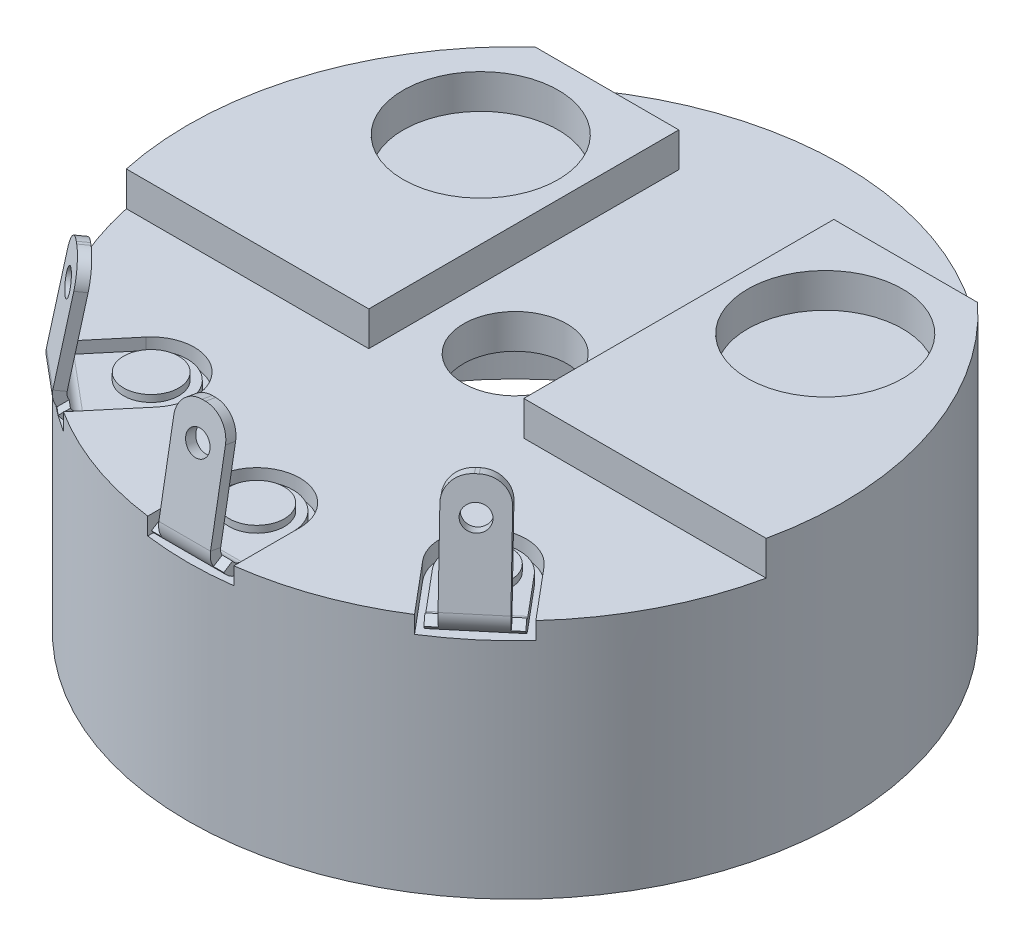
from build123d import *
from build123d.topology import SkipClean

# Parameters (mm, degrees)
SKETCH1_R                  = 0.75
BOSS_EXTRUDE2_DEPTH        = 0.5
SKETCH1_4_R                = 1.125
BOSS_EXTRUDE3_DEPTH        = 1
SKETCH1_5_R                = 1.125
BOSS_EXTRUDE4_DEPTH        = 0.5
SKETCH1_6_R                = 1.125
BOSS_EXTRUDE5_DEPTH        = 0.5
SKETCH2_R                  = 0.375
CUT_EXTRUDE1_DEPTH         = 7.736096793
CUT_EXTRUDE2_START         = -0.25
CUT_EXTRUDE2_DEPTH         = 0.25
CIRPATTERN2_COUNT          = 3
CIRPATTERN2_ANGLE          = 80
EXTRUDE_THIN2_START        = -3
SKETCH1_8_R                = 4.75
SKETCH1_8_R_2              = 4.5
EXTRUDE_THIN2_DEPTH        = 3
BASE_FLANGE1_START         = 0.15
SKETCH4_R                  = 0.375
SKETCH4_R_2                = 0.175
BASE_FLANGE1_DEPTH         = 0.15
SKETCHED_START             = -0.525
SKETCHED_BEND1_DEPTH       = 1.05
SKETCHED_BEND1_2_DEPTH     = 1.05
SKETCHED_START_2           = -0.375
SKETCHED_BEND1_3_DEPTH     = 0.75
SKETCHED_START_3           = -4.828299493
SKETCHED_BEND1_4_OUTLINE_R = 0.175
SKETCHED_BEND1_4_DEPTH     = 0.149999999
SKETCH10_R                 = 0.375
BASE_FLANGE3_DEPTH         = 0.15
CIRPATTERN3_COUNT          = 3
CIRPATTERN3_ANGLE          = 80


with BuildPart() as part:
    # Sketch1 → Boss-Extrude2 (new body)
    with BuildSketch(Plane(origin=(0, 0, 0), x_dir=(1, 0, 0), z_dir=(0, 1, 0))):
        with BuildLine():
            Line((-1.125, 3.5), (-1.125, -1))
            Line((-1.125, -1), (-4.643543905, -1))
            ThreePointArc((-4.643543905, -1), (0, -4.75), (4.643543905, -1))
            Line((4.643543905, -1), (1.125, -1))
            Line((1.125, -1), (1.125, 3.5))
            Line((1.125, 3.5), (3.211308145, 3.5))
            ThreePointArc((3.211308145, 3.5), (0, 4.75), (-3.211308145, 3.5))
            Line((-3.211308145, 3.5), (-1.125, 3.5))
        make_face()
        with Locations(Location((0, 0, 0), (0, 0, 270))):
            Circle(SKETCH1_R, mode=Mode.SUBTRACT)
    extrude(amount=BOSS_EXTRUDE2_DEPTH)

    # Sketch1<4> → Boss-Extrude3 (add)
    # profile 1 of 2: a face of its own
    with BuildSketch(Plane(origin=(0, 0, 0), x_dir=(1, 0, 0), z_dir=(0, 1, 0))):
        with BuildLine():
            ThreePointArc((-3.211308145, 3.5), (-4.526276083, 1.440598771), (-4.643543905, -1))
            Line((-4.643543905, -1), (-1.125, -1))
            Line((-1.125, -1), (-1.125, 3.5))
            Line((-1.125, 3.5), (-3.211308145, 3.5))
        make_face()
        with Locations(Location((-2.5, 2, 0), (0, 0, 270))):
            Circle(SKETCH1_4_R, mode=Mode.SUBTRACT)
    # profile 2 of 2: a face of its own
    with BuildSketch(Plane(origin=(0, 0, 0), x_dir=(1, 0, 0), z_dir=(0, 1, 0))):
        with BuildLine():
            Line((1.125, -1), (4.643543905, -1))
            ThreePointArc((4.643543905, -1), (4.723310997, -0.502825243), (4.75, 0))
            ThreePointArc((4.75, 0), (4.348345299, 1.911646713), (3.211308145, 3.5))
            Line((3.211308145, 3.5), (1.125, 3.5))
            Line((1.125, 3.5), (1.125, -1))
        make_face()
        with Locations(Location((2.5, 2, 0), (0, 0, 270))):
            Circle(SKETCH1_4_R, mode=Mode.SUBTRACT)
    extrude(amount=BOSS_EXTRUDE3_DEPTH)

    # Sketch1<5> → Boss-Extrude4 (add)
    with BuildSketch(Plane(origin=(0, 0, 0), x_dir=(1, 0, 0), z_dir=(0, 1, 0))):
        with Locations(Location((2.5, 2, 0), (0, 0, 270))):
            Circle(SKETCH1_5_R)
    extrude(amount=BOSS_EXTRUDE4_DEPTH)

    # Sketch1<6> → Boss-Extrude5 (add)
    with BuildSketch(Plane(origin=(0, 0, 0), x_dir=(1, 0, 0), z_dir=(0, 1, 0))):
        with Locations(Location((-2.5, 2, 0), (0, 0, 270))):
            Circle(SKETCH1_6_R)
    extrude(amount=BOSS_EXTRUDE5_DEPTH)

    # Sketch2 → Cut-Extrude1 (cut, through all)
    with BuildSketch(Plane(origin=(0, 0.5, 0), x_dir=(1, 0, 0), z_dir=(0, 1, 0))):
        with Locations(Location((-2.410453536, -2.872666662, 0), (0, 0, 270))):
            Circle(SKETCH2_R)
    cut_extrude1 = extrude(amount=-CUT_EXTRUDE1_DEPTH, mode=Mode.SUBTRACT)

    # Sketch2<4> → Cut-Extrude2 (cut)
    with BuildSketch(Plane(origin=(0, 0.5, 0), x_dir=(1, 0, 0), z_dir=(0, 1, 0)).offset(CUT_EXTRUDE2_START)):
        with BuildLine():
            Line((-3.505473113, -3.205332784), (-2.889231313, -2.470924406))
            ThreePointArc((-2.889231313, -2.470924406), (-2.00871128, -2.393888885), (-1.931675759, -3.274408918))
            Line((-1.931675759, -3.274408918), (-2.547917559, -4.008817296))
            ThreePointArc((-2.547917559, -4.008817296), (-3.053241146, -3.638711105), (-3.505473113, -3.205332784))
        make_face()
    cut_extrude2 = extrude(amount=CUT_EXTRUDE2_DEPTH, mode=Mode.SUBTRACT)

    # CirPattern2: Cut-Extrude1, Cut-Extrude2 ×3 about axis
    cirpattern2_axis = Axis((0, 0, 0), (0, 1, 0))
    add([cut_extrude1.rotate(cirpattern2_axis, i * CIRPATTERN2_ANGLE / (CIRPATTERN2_COUNT - 1)) for i in range(1, CIRPATTERN2_COUNT)], mode=Mode.SUBTRACT)
    add([cut_extrude2.rotate(cirpattern2_axis, i * CIRPATTERN2_ANGLE / (CIRPATTERN2_COUNT - 1)) for i in range(1, CIRPATTERN2_COUNT)], mode=Mode.SUBTRACT)

    # Sketch1<8> → Extrude-Thin2 (add)
    with BuildSketch(Plane(origin=(0, 0, 0), x_dir=(1, 0, 0), z_dir=(0, 1, 0)).offset(EXTRUDE_THIN2_START)):
        Circle(SKETCH1_8_R)
        Circle(SKETCH1_8_R_2, mode=Mode.SUBTRACT)
    extrude(amount=EXTRUDE_THIN2_DEPTH)


with BuildPart() as body_2:
    # Base-Flange1: sheet metal written as solids
    # Sketch4 → Base-Flange1 (new body)
    with BuildSketch(Plane(origin=(0, 0.25, 0), x_dir=(1, 0, 0), z_dir=(0, 1, 0)).offset(BASE_FLANGE1_START)):
        with BuildLine():
            Line((-2.008280204, -3.210130157), (-2.624522003, -3.944538535))
            Line((-2.624522003, -3.944538535), (-2.73942867, -3.848120394))
            Line((-2.73942867, -3.848120394), (-3.639331323, -4.920582614))
            ThreePointArc((-3.639331323, -4.920582614), (-3.876942368, -5.044275095), (-4.132422542, -4.963722506))
            Line((-4.132422542, -4.963722506), (-4.170724764, -4.931583125))
            ThreePointArc((-4.170724764, -4.931583125), (-4.294417245, -4.69397208), (-4.213864655, -4.438491907))
            Line((-4.213864655, -4.438491907), (-3.313962002, -3.366029686))
            Line((-3.313962002, -3.366029686), (-3.428868668, -3.269611545))
            Line((-3.428868668, -3.269611545), (-2.812626869, -2.535203167))
            ThreePointArc((-2.812626869, -2.535203167), (-2.072990041, -2.470493329), (-2.008280204, -3.210130157))
        make_face()
        with Locations(Location((-2.410453536, -2.872666662, 0), (0, 0, 270))):
            Circle(SKETCH4_R, mode=Mode.SUBTRACT)
        with Locations(Location((-3.830179848, -4.564630594, 0), (0, 0, 270))):
            Circle(SKETCH4_R_2, mode=Mode.SUBTRACT)
    extrude(amount=-BASE_FLANGE1_DEPTH)

    # Sketched Bend1: read off the stored shape, not the designer's step
    # Sketched Bend1 outline → Sketched Bend1 (cut)
    with BuildSketch(Plane(origin=(0, 0, 0), x_dir=(0.642787609686537, 0, -0.76604444311898), z_dir=(0.76604444311898, 0, 0.642787609686537)).offset(SKETCHED_START)):
        with BuildLine():
            Line((-4.760983594, 0.4), (-6.45870205, 0.4))
            Line((-6.45870205, 0.4), (-6.45870205, 0.25))
            Line((-6.45870205, 0.25), (-4.501175973, 0.25))
            ThreePointArc((-4.501175973, 0.25), (-4.651175973, 0.290192379), (-4.760983594, 0.4))
        make_face()
    extrude(amount=SKETCHED_BEND1_DEPTH, mode=Mode.SUBTRACT)

    # Sketched Bend1 2 outline → Sketched Bend1 2 (add)
    with SkipClean():  # the faces are left unmerged after this step: merging them gives an invalid solid
        with BuildSketch(Plane(origin=(0, 0, 0), x_dir=(0.642787609686537, 0, -0.76604444311898), z_dir=(0.76604444311898, 0, 0.642787609686537)).offset(SKETCHED_START)):
            with BuildLine():
                ThreePointArc((-4.501175973, 0.4), (-4.57325702, 0.418454105), (-4.627602184, 0.469275698))
                Line((-4.627602184, 0.469275698), (-4.754028396, 0.388551395))
                ThreePointArc((-4.754028396, 0.388551395), (-4.73301345, 0.359602037), (-4.70870205, 0.333359913))
                Line((-4.70870205, 0.333359913), (-4.70870205, 0.4))
                Line((-4.70870205, 0.4), (-4.501175973, 0.4))
            make_face()
        extrude(amount=SKETCHED_BEND1_2_DEPTH)

    # Sketched Bend1 3 outline → Sketched Bend1 3 (add)
    with SkipClean():  # the faces are left unmerged after this step: merging them gives an invalid solid
        with BuildSketch(Plane(origin=(0, 0, 0), x_dir=(0.642787609686537, 0, -0.76604444311898), z_dir=(0.76604444311898, 0, 0.642787609686537)).offset(SKETCHED_START_2)):
            with BuildLine():
                ThreePointArc((-4.627602184, 0.469275698), (-4.648278779, 0.520661214), (-4.648897136, 0.576047227))
                Line((-4.648897136, 0.576047227), (-4.371712461, 2.148039633))
                Line((-4.371712461, 2.148039633), (-4.519433624, 2.174086859))
                Line((-4.519433624, 2.174086859), (-4.796618299, 0.602094453))
                ThreePointArc((-4.796618299, 0.602094453), (-4.796618299, 0.497905546), (-4.760983594, 0.4))
                Line((-4.760983594, 0.4), (-4.736098185, 0.4))
                Line((-4.736098185, 0.4), (-4.627602184, 0.469275698))
            make_face()
        extrude(amount=SKETCHED_BEND1_3_DEPTH)

    # Sketched Bend1 4 outline → Sketched Bend1 4 (cut)
    with SkipClean():  # the faces are left unmerged after this step: merging them gives an invalid solid
        with BuildSketch(Plane(origin=(0, 0, 0), x_dir=(0.7741336234862116, 0.1419950663058067, 0.6168910228986297), z_dir=(0.633022221559487, -0.173648177666934, -0.75440650673549)).offset(SKETCHED_START_3)):
            with BuildLine():
                Line((-0.175527489, -1.396163693), (0.170815245, -1.345698743))
                ThreePointArc((0.170815245, -1.345698743), (-0.088866892, -1.279941413), (-0.225992438, -1.049820959))
                Line((-0.225992438, -1.049820959), (-0.175527489, -1.396163693))
            make_face()
            with BuildLine():
                ThreePointArc((0.516170562, -0.941681782), (0.450413232, -1.201363919), (0.220292778, -1.338489465))
                Line((0.220292778, -1.338489465), (0.566635511, -1.288024516))
                Line((0.566635511, -1.288024516), (0.516170562, -0.941681782))
            make_face()
            with Locations((0.123461227, -0.847318771)):
                Circle(SKETCHED_BEND1_4_OUTLINE_R)
        extrude(amount=SKETCHED_BEND1_4_DEPTH, mode=Mode.SUBTRACT)


with BuildPart() as body_3:
    # Base-Flange3: sheet metal written as solids
    # Sketch10 → Base-Flange3 (new body)
    with BuildSketch(Plane.XZ):
        with BuildLine():
            ThreePointArc((-2.828265483, 3.37059555), (0, -4.4), (2.828265483, 3.37059555))
            ThreePointArc((2.828265483, 3.37059555), (1.912524648, 3.290478608), (1.99264159, 2.374737774))
            ThreePointArc((1.99264159, 2.374737774), (0, -3.1), (-1.99264159, 2.374737774))
            ThreePointArc((-1.99264159, 2.374737774), (-1.912524648, 3.290478608), (-2.828265483, 3.37059555))
        make_face()
        with Locations(Location((-2.410453536, 2.872666662, 0), (0, 0, 270))):
            Circle(SKETCH10_R, mode=Mode.SUBTRACT)
        with Locations(Location((2.410453536, 2.872666662, 0), (0, 0, 270))):
            Circle(SKETCH10_R, mode=Mode.SUBTRACT)
    extrude(amount=BASE_FLANGE3_DEPTH)


with BuildPart() as body_4:
    # Sketch16 → Revolve1 (revolve)
    with BuildSketch(Plane(origin=(0, 0, 0), x_dir=(-0.642787609686535, 0, 0.7660444431189818), z_dir=(-0.7660444431189817, 0, -0.6427876096865349)), mode=Mode.PRIVATE) as revolve1_sk:
        Polygon((3.375, 0.4), (3.35, 0.4), (3.35, 0.5), (3.75, 0.5), (3.75, -0.238591808), (3.35, -0.238591808), (3.35, -0.15), (3.375, -0.15), align=None)
    revolve(revolve1_sk.sketch.rotate(Axis((-2.410453536, 0.5, 2.872666662), (0, -1, 0)), 140), axis=Axis((-2.410453536, 0.5, 2.872666662), (0, -1, 0)))


with BuildPart() as cirpattern3_1:
    # CirPattern3: pattern copy
    add(body_4.part.rotate(Axis((0, 0, 0), (0, 1, 0)), 1 * CIRPATTERN3_ANGLE / (CIRPATTERN3_COUNT - 1)))


with BuildPart() as cirpattern3_2:
    # CirPattern3: pattern copy
    add(body_4.part.rotate(Axis((0, 0, 0), (0, 1, 0)), 2 * CIRPATTERN3_ANGLE / (CIRPATTERN3_COUNT - 1)))


with BuildPart() as cirpattern3_3:
    # CirPattern3: pattern copy
    add(body_2.part.rotate(Axis((0, 0, 0), (0, 1, 0)), 1 * CIRPATTERN3_ANGLE / (CIRPATTERN3_COUNT - 1)))


with BuildPart() as cirpattern3_4:
    # CirPattern3: pattern copy
    add(body_2.part.rotate(Axis((0, 0, 0), (0, 1, 0)), 2 * CIRPATTERN3_ANGLE / (CIRPATTERN3_COUNT - 1)))


solid = Compound([part.part, body_2.part, body_3.part, body_4.part, cirpattern3_1.part, cirpattern3_2.part, cirpattern3_3.part, cirpattern3_4.part])
